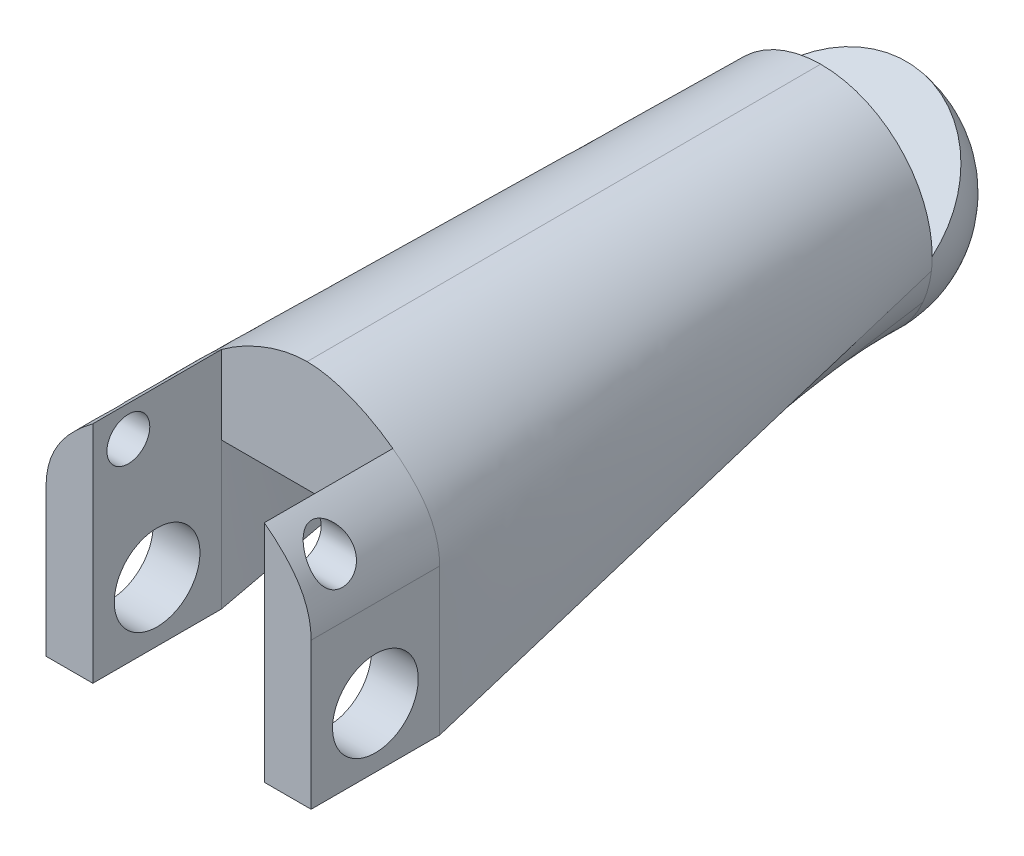
from build123d import *

# Parameters (mm, degrees)
BOSS_EXTRUDE1_DEPTH     = 3
SKETCH5_R               = 1
CUT_EXTRUDE1_DEPTH      = 24
REVOLVE1_ANGLE          = 130
CUT_EXTRUDE2_START      = -3
CUT_EXTRUDE2_DEPTH      = 3
CUT_EXTRUDE3_DEPTH      = 16.294160731
CUT_EXTRUDE3_DEPTH_BACK = 16.294160731
SKETCH8_R               = 0.5


with BuildPart() as part:
    # Loft1: read off the stored shape, not the designer's step
    # Loft1: loft between two sections, ruled curve by curve
    loft1_from = [
        Edge.make_bspline([(-0.01934999, 2.583260864, -12), (-0.12870412, 2.582441743, -12), (-0.352052901, 2.566712627, -12), (-0.69196248, 2.49738866, -12), (-1.027723307, 2.378876735, -12), (-1.348064896, 2.213855273, -12), (-1.641716759, 2.005002694, -12), (-1.901125968, 1.761102566, -12), (-2.118739593, 1.49093846, -12), (-2.235234683, 1.29972921, -12), (-2.35435273, 1.073350555, -12), (-2.458631501, 0.823593102, -12), (-2.552714219, 0.453231677, -12), (-2.591894644, 0.07317688, -12), (-2.579952112, -0.197244237, -12), (-2.560541561, -0.342400387, -12)], [0, 0, 0, 0, 0.074868837, 0.149737674, 0.224606512, 0.299475349, 0.374344186, 0.449213023, 0.52408186, 0.598950697, 0.598950697, 0.699213023, 0.799475349, 0.899737674, 1, 1, 1, 1], 3),
        Edge.make_bspline([(-2.560541561, -0.342400387, -12), (-2.552179672, -0.404932339, -12), (-2.530896436, -0.529217273, -12), (-2.485503098, -0.71257565, -12), (-2.426851171, -0.892132885, -12), (-2.379050754, -1.008815537, -12), (-2.353010745, -1.0662793, -12)], [0, 0, 0, 0, 0.25, 0.5, 0.75, 1, 1, 1, 1], 3),
        Edge.make_bspline([(2.565383476, -0.304004497, -12), (2.582617384, -0.158573806, -12), (2.590489998, 0.111964311, -12), (2.545633291, 0.491446815, -12), (2.446046116, 0.860308715, -12), (2.33800955, 1.108498781, -12), (2.215513655, 1.333067645, -12), (2.096167306, 1.522510287, -12), (1.874530999, 1.789384177, -12), (1.611497206, 2.029370957, -12), (1.314749599, 2.233801165, -12), (0.991971851, 2.39400534, -12), (0.654473334, 2.507474198, -12), (0.313563418, 2.571698452, -12), (0.090004112, 2.584079984, -12), (-0.01934999, 2.583260864, -12)], [0, 0, 0, 0, 0.100262364, 0.200524727, 0.300787091, 0.401049454, 0.401049454, 0.475918272, 0.550787091, 0.625655909, 0.700524727, 0.775393545, 0.850262364, 0.925131182, 1, 1, 1, 1], 3),
        Edge.make_bspline([(-2.353010745, -1.0662793, -12), (-2.29771989, -1.188292337, -12), (-2.168849346, -1.422215103, -12), (-1.925452005, -1.737497814, -12), (-1.636738114, -2.011887579, -12), (-1.41723447, -2.164024451, -12), (-1.301521549, -2.23151356, -12)], [0, 0, 0, 0, 0.25, 0.5, 0.75, 1, 1, 1, 1], 3),
        Edge.make_bspline([(-1.301521549, -2.23151356, -12), (-1.097491105, -2.350513518, -12), (-0.665032412, -2.528066554, -12), (0.019575259, -2.613334671, -12), (0.702828775, -2.51782055, -12), (1.132579159, -2.333809112, -12), (1.334804064, -2.211766087, -12)], [0, 0, 0, 0, 0.25, 0.5, 0.75, 1, 1, 1, 1], 3),
        Edge.make_bspline([(1.334804064, -2.211766087, -12), (1.449492999, -2.142551147, -12), (1.666692969, -1.987143133, -12), (1.951264045, -1.708459161, -12), (2.189911071, -1.389565682, -12), (2.315262941, -1.153738656, -12), (2.36871981, -1.030911041, -12)], [0, 0, 0, 0, 0.25, 0.5, 0.75, 1, 1, 1, 1], 3),
        Edge.make_bspline([(2.36871981, -1.030911041, -12), (2.393896077, -0.97306364, -12), (2.439943199, -0.855678021, -12), (2.495898739, -0.675262315, -12), (2.538540234, -0.491244511, -12), (2.557959267, -0.366654695, -12), (2.565383476, -0.304004497, -12)], [0, 0, 0, 0, 0.25, 0.5, 0.75, 1, 1, 1, 1], 3),
    ]
    loft1_to = [
        Edge.make_bspline([(0, 2.583333333, 0), (-0.194758696, 2.583333333, 0), (-0.572822925, 2.527886539, 0), (-1.095230667, 2.35354965, 0), (-1.578621904, 2.115029917, 0), (-2.024365458, 1.822933485, 0), (-2.431315545, 1.478435559, 0), (-2.786336259, 1.071485923, 0), (-3.036283572, 0.574778229, 0), (-3.092592593, 0.194758696, 0), (-3.092592593, -0.260816816, 0), (-3.092592593, -0.81342571, 0), (-3.092592593, -1.708333333, 0), (-3.092592593, -2.603240956, 0), (-3.092592593, -3.15584985, 0), (-3.092592593, -3.416666667, 0)], [0, 0, 0, 0, 0.074868837, 0.149737674, 0.224606512, 0.299475349, 0.374344186, 0.449213023, 0.52408186, 0.598950697, 0.598950697, 0.699213023, 0.799475349, 0.899737674, 1, 1, 1, 1], 3),
        Edge.make_bspline([(-3.092592593, -3.416666667, 0), (-3.00154321, -3.416666667, 0), (-2.819444444, -3.416666667, 0), (-2.546296296, -3.416666667, 0), (-2.273148148, -3.416666667, 0), (-2.091049383, -3.416666667, 0), (-2, -3.416666667, 0)], [0, 0, 0, 0, 0.25, 0.5, 0.75, 1, 1, 1, 1], 3),
        Edge.make_bspline([(3.092592593, -3.416666667, 0), (3.092592593, -3.155849948, 0), (3.092592593, -2.603241145, 0), (3.092592593, -1.708333333, 0), (3.092592593, -0.813425522, 0), (3.092592593, -0.260816718, 0), (3.092592593, 0.19475876, 0), (3.036283535, 0.574778362, 0), (2.786336177, 1.071486034, 0), (2.431315484, 1.478435612, 0), (2.024365456, 1.822933483, 0), (1.578621973, 2.115029874, 0), (1.095230792, 2.353549597, 0), (0.572823057, 2.527886507, 0), (0.19475876, 2.583333333, 0), (0, 2.583333333, 0)], [0, 0, 0, 0, 0.100262364, 0.200524727, 0.300787091, 0.401049454, 0.401049454, 0.475918272, 0.550787091, 0.625655909, 0.700524727, 0.775393545, 0.850262364, 0.925131182, 1, 1, 1, 1], 3),
        Edge.make_bspline([(-2, -3.416666667, 0), (-2, -3.131944444, 0), (-2, -2.5625, 0), (-2, -1.708333333, 0), (-2, -0.854166667, 0), (-2, -0.284722222, 0), (-2, 0, 0)], [0, 0, 0, 0, 0.25, 0.5, 0.75, 1, 1, 1, 1], 3),
        Edge.make_bspline([(-2, 0, 0), (-1.666666667, 0, 0), (-1, 0, 0), (0, 0, 0), (1, 0, 0), (1.666666667, 0, 0), (2, 0, 0)], [0, 0, 0, 0, 0.25, 0.5, 0.75, 1, 1, 1, 1], 3),
        Edge.make_bspline([(2, 0, 0), (2, -0.284722222, 0), (2, -0.854166667, 0), (2, -1.708333333, 0), (2, -2.5625, 0), (2, -3.131944444, 0), (2, -3.416666667, 0)], [0, 0, 0, 0, 0.25, 0.5, 0.75, 1, 1, 1, 1], 3),
        Edge.make_bspline([(2, -3.416666667, 0), (2.091049383, -3.416666667, 0), (2.273148148, -3.416666667, 0), (2.546296296, -3.416666667, 0), (2.819444444, -3.416666667, 0), (3.00154321, -3.416666667, 0), (3.092592593, -3.416666667, 0)], [0, 0, 0, 0, 0.25, 0.5, 0.75, 1, 1, 1, 1], 3),
    ]
    loft1 = Solid(Shell([*[Face.make_surface_from_curves(loft1_from[k], loft1_to[k]) for k in range(7)], Face(Wire(loft1_from)), Face(Wire(loft1_to))]))
    add(loft1)

    # Sketch4 → Boss-Extrude1 (add)
    with BuildSketch(Plane.XY):
        with BuildLine():
            Line((2, -3.416666667), (3.092592593, -3.416666667))
            Line((3.092592593, -3.416666667), (3.092592593, 0))
            add(Edge.make_bspline(
                [(3.092592593, 0), (3.092592593, 0.657213879), (2.315221802, 1.857472098), (0.757450401, 2.583333333), (0, 2.583333333)],
                knots=[0, 0, 0, 0, 0.400679254, 1, 1, 1, 1], degree=3))
            add(Edge.make_bspline(
                [(0, 2.583333333), (-0.757450401, 2.583333333), (-2.315221802, 1.857472098), (-3.092592593, 0.657213879), (-3.092592593, 0)],
                knots=[0, 0, 0, 0, 0.599320746, 1, 1, 1, 1], degree=3))
            Line((-3.092592593, 0), (-3.092592593, -3.416666667))
            Line((-3.092592593, -3.416666667), (-2, -3.416666667))
            Line((-2, -3.416666667), (-2, 0))
            Line((-2, 0), (2, 0))
            Line((2, 0), (2, -3.416666667))
        make_face()
    extrude(amount=BOSS_EXTRUDE1_DEPTH)

    # Sketch5 → Cut-Extrude1 (cut)
    with BuildSketch(Plane(origin=(3.092592593, 0, 0), x_dir=(0, 0, -1), z_dir=(1, 0, 0))):
        with Locations(Location((-1.5, -2.026197999, 0), (0, 0, 90))):
            Circle(SKETCH5_R)
    extrude(amount=-CUT_EXTRUDE1_DEPTH, mode=Mode.SUBTRACT)

    # Sketch6 → Revolve1 (revolve)
    with BuildSketch(Plane(origin=(0, 0, -12), x_dir=(-1, 0, 0), z_dir=(0, 0, -1))):
        with BuildLine():
            Line((2.583333333, 0), (-2.583333333, 0))
            ThreePointArc((-2.583333333, 0), (-2.578841965, -0.152266979), (-2.565383476, -0.304004497))
            ThreePointArc((-2.565383476, -0.304004497), (-2.49368043, -0.674662155), (-2.36871981, -1.030911041))
            ThreePointArc((-2.36871981, -1.030911041), (-1.943611826, -1.701759143), (-1.334804064, -2.211766087))
            ThreePointArc((-1.334804064, -2.211766087), (-0.01934999, -2.583260864), (1.301521549, -2.23151356))
            ThreePointArc((1.301521549, -2.23151356), (1.917901012, -1.730683917), (2.353010745, -1.0662793))
            ThreePointArc((2.353010745, -1.0662793), (2.483294029, -0.711942326), (2.560541561, -0.342400387))
            ThreePointArc((2.560541561, -0.342400387), (2.577629093, -0.171579056), (2.583333333, 0))
        make_face()
    revolve(axis=Axis((2.583333333, 0, -12), (1, 0, 0)), revolution_arc=REVOLVE1_ANGLE)

    # Cut-Extrude2: read off the stored shape, not the designer's step
    # Cut-Extrude2 outline → Cut-Extrude2 (cut)
    with BuildSketch(Plane.XY.offset(3).offset(CUT_EXTRUDE2_START)):
        with BuildLine():
            Line((-2, 0), (2, 0))
            Line((2, 0), (2.000000128, 1.827559626))
            add(Edge.make_bspline(
                [(2.000000128, 1.827559626), (1.387657851, 2.280065503), (0.632427745, 2.583333333), (-0.632427668, 2.583333333), (-1.387657668, 2.280065577), (-1.999999905, 1.827559791)],
                knots=[0.499601469, 0.499601469, 0.499601469, 0.499601469, 1, 1, 1.50039847, 1.50039847, 1.50039847, 1.50039847], degree=3))
            Line((-1.999999905, 1.827559791), (-2, 0))
        make_face()
    extrude(amount=CUT_EXTRUDE2_DEPTH, mode=Mode.SUBTRACT)

    # Sketch8 → Cut-Extrude3 (cut, two sides: drawn at the far end of the back side and taken through both)
    with BuildSketch(Plane(origin=(0, 0, 0), x_dir=(0, 0, -1), z_dir=(1, 0, 0)).offset(-CUT_EXTRUDE3_DEPTH_BACK)):
        with Locations((-2.171199761, 1.105428282)):
            Circle(SKETCH8_R)
    extrude(amount=CUT_EXTRUDE3_DEPTH + CUT_EXTRUDE3_DEPTH_BACK, mode=Mode.SUBTRACT)


solid = part.part
